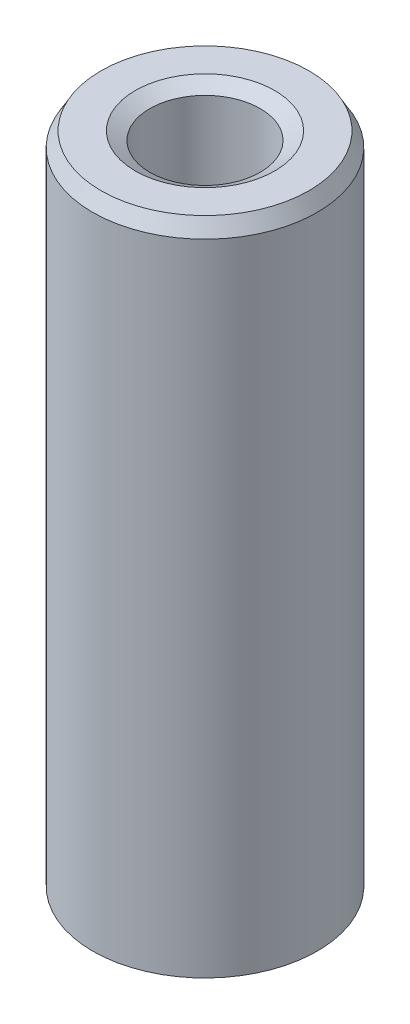
from build123d import *
from OCP.BRepFilletAPI import BRepFilletAPI_MakeChamfer

# Parameters (mm, degrees)
SKETCH1_R           = 20
BOSS_EXTRUDE1_DEPTH = 118.010384904
SKETCH2_R           = 9.830441929
CUT_EXTRUDE1_DEPTH  = 122.352589363
CHAMFER1_SIZE       = 2.586828358
CHAMFER1_SIZE2      = 1.493506049


with BuildPart() as part:
    # Sketch1 → Boss-Extrude1 (new body)
    with BuildSketch(Plane(origin=(0, 0, 0), x_dir=(1, 0, 0), z_dir=(0, 1, 0))):
        Circle(SKETCH1_R)
    extrude(amount=BOSS_EXTRUDE1_DEPTH)

    # Sketch2 → Cut-Extrude1 (cut, through all)
    with BuildSketch(Plane(origin=(0, 0, 0), x_dir=(1, 0, 0), z_dir=(0, 1, 0))):
        Circle(SKETCH2_R)
    extrude(amount=CUT_EXTRUDE1_DEPTH, mode=Mode.SUBTRACT)

    # Chamfer1: one chamfer whose edges measure the first distance from different faces: ONE call of the kernel's chamfer builder (chamfer() names one face for all edges)
    chamfer1_edges_1 = [part.edges().sort_by_distance(p)[0] for p in [
        (-9.830441929, 118.010384904, 0),
    ]]
    chamfer1_side_1 = [part.faces().sort_by_distance(p)[0] for p in [
        (-19.434314575, 118.010384904, 0),
    ]]
    chamfer1_edges_2 = [part.edges().sort_by_distance(p)[0] for p in [
        (-9.830441929, 0, 0),
    ]]
    chamfer1_side_2 = [part.faces().sort_by_distance(p)[0] for p in [
        (-9.830441929, 59.005192452, 0),
    ]]
    chamfer1_edges_3 = [part.edges().sort_by_distance(p)[0] for p in [
        (-20, 0, 0),
    ]]
    chamfer1_side_3 = [part.faces().sort_by_distance(p)[0] for p in [
        (-19.434314575, 0, 0),
    ]]
    chamfer1_edges_4 = [part.edges().sort_by_distance(p)[0] for p in [
        (-20, 118.010384904, 0),
    ]]
    chamfer1_side_4 = [part.faces().sort_by_distance(p)[0] for p in [
        (-20, 59.005192452, 0),
    ]]
    chamfer1 = BRepFilletAPI_MakeChamfer(part.part.solid().wrapped)
    for e in chamfer1_edges_1:
        chamfer1.Add(CHAMFER1_SIZE, CHAMFER1_SIZE2, e.wrapped, chamfer1_side_1[0].wrapped)  # the first distance lies on this face
    for e in chamfer1_edges_2:
        chamfer1.Add(CHAMFER1_SIZE, CHAMFER1_SIZE2, e.wrapped, chamfer1_side_2[0].wrapped)  # the first distance lies on this face
    for e in chamfer1_edges_3:
        chamfer1.Add(CHAMFER1_SIZE, CHAMFER1_SIZE2, e.wrapped, chamfer1_side_3[0].wrapped)  # the first distance lies on this face
    for e in chamfer1_edges_4:
        chamfer1.Add(CHAMFER1_SIZE, CHAMFER1_SIZE2, e.wrapped, chamfer1_side_4[0].wrapped)  # the first distance lies on this face
    add(Compound.cast(chamfer1.Shape()), mode=Mode.REPLACE)


solid = part.part
